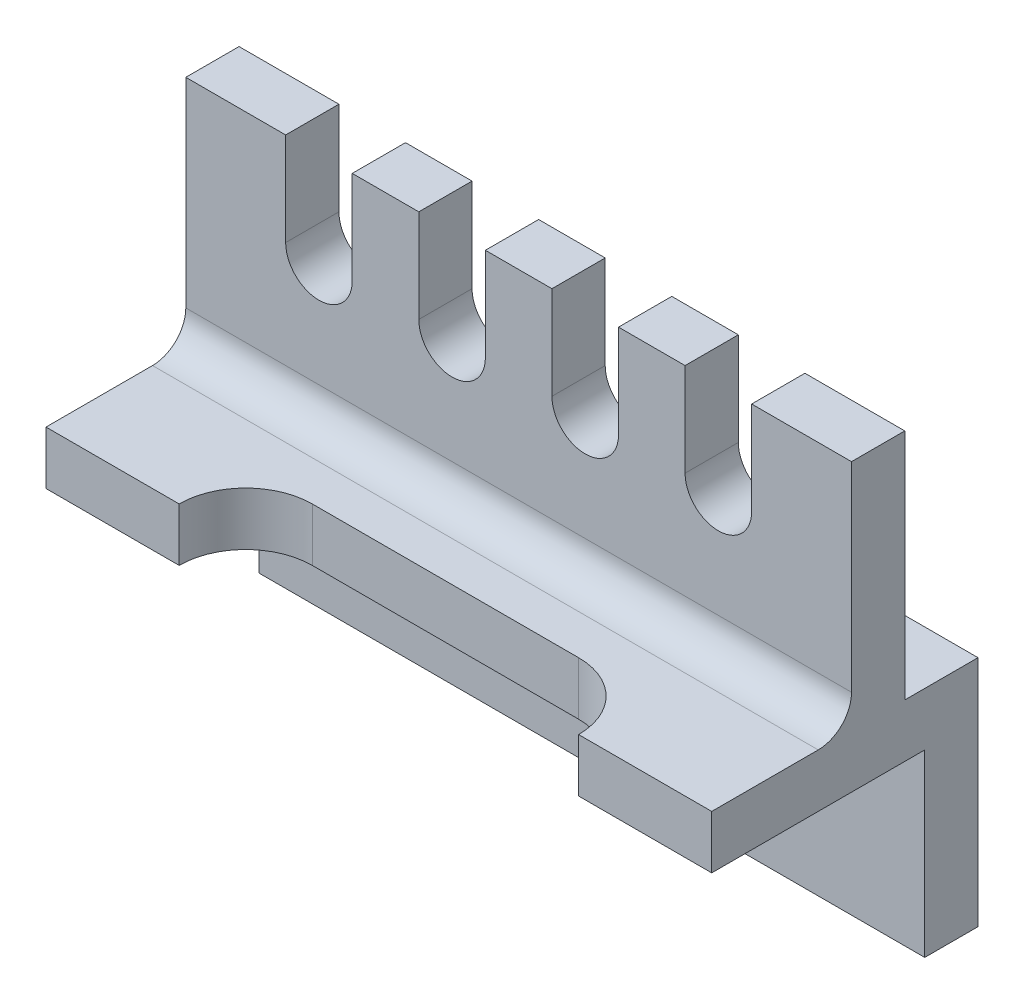
from build123d import *

# Parameters (mm, degrees)
SKETCH1_W           = 100
SKETCH1_H           = 8
BOSS_EXTRUDE1_DEPTH = 35
SKETCH2_W           = 100
SKETCH2_H           = 8
BOSS_EXTRUDE2_DEPTH = 40
SKETCH6_W           = 60
SKETCH6_H           = 8
CUT_EXTRUDE2_DEPTH  = 10
FILLET1_R           = 10
SKETCH8_W           = 100
SKETCH8_H           = 8
BOSS_EXTRUDE3_DEPTH = 35
CUT_EXTRUDE3_DEPTH  = 8
FILLET2_R           = 5


with BuildPart() as part:
    # Sketch1 → Boss-Extrude1 (new body)
    with BuildSketch(Plane(origin=(0, 0, 0), x_dir=(1, 0, 0), z_dir=(0, 1, 0))):
        with Locations((-50, -4)):
            Rectangle(SKETCH1_W, SKETCH1_H)
    extrude(amount=BOSS_EXTRUDE1_DEPTH)

    # Sketch2 → Boss-Extrude2 (add)
    with BuildSketch(Plane.XY):
        with Locations((-50, 31)):
            Rectangle(SKETCH2_W, SKETCH2_H)
    extrude(amount=BOSS_EXTRUDE2_DEPTH)

    # Sketch6 → Cut-Extrude2 (cut)
    with BuildSketch(Plane.XY.offset(40)):
        with Locations((-50, 31)):
            Rectangle(SKETCH6_W, SKETCH6_H)
    extrude(amount=-CUT_EXTRUDE2_DEPTH, mode=Mode.SUBTRACT)

    # Fillet1
    fillet1_edges = [part.edges().sort_by_distance(p)[0] for p in [
        (-20, 31, 30),
        (-80, 31, 30),
    ]]
    fillet(fillet1_edges, radius=FILLET1_R - 0.0001)  # a hair under: the kernel refuses the full size

    # Sketch8 → Boss-Extrude3 (add)
    with BuildSketch(Plane(origin=(0, 35, 0), x_dir=(1, 0, 0), z_dir=(0, 1, 0))):
        with Locations((-50, -15)):
            Rectangle(SKETCH8_W, SKETCH8_H)
    extrude(amount=BOSS_EXTRUDE3_DEPTH)

    # Sketch9 → Cut-Extrude3 (cut)
    with BuildSketch(Plane.XY.offset(19)):
        with BuildLine():
            Line((-85, 70), (-85, 56))
            ThreePointArc((-85, 56), (-80, 51), (-75, 56))
            Line((-75, 56), (-75, 70))
            Line((-75, 70), (-85, 70))
        make_face()
        with BuildLine():
            Line((-65, 70), (-65, 56))
            ThreePointArc((-65, 56), (-60, 51), (-55, 56))
            Line((-55, 56), (-55, 70))
            Line((-55, 70), (-65, 70))
        make_face()
        with BuildLine():
            Line((-45, 70), (-45, 56))
            ThreePointArc((-45, 56), (-40, 51), (-35, 56))
            Line((-35, 56), (-35, 70))
            Line((-35, 70), (-45, 70))
        make_face()
        with BuildLine():
            Line((-25, 70), (-25, 56))
            ThreePointArc((-25, 56), (-20, 51), (-15, 56))
            Line((-15, 56), (-15, 70))
            Line((-15, 70), (-25, 70))
        make_face()
    extrude(amount=-CUT_EXTRUDE3_DEPTH, mode=Mode.SUBTRACT)

    # Fillet2
    fillet2_edges = [part.edges().sort_by_distance(p)[0] for p in [
        (-50, 35, 19),
    ]]
    fillet(fillet2_edges, radius=FILLET2_R)


solid = part.part
